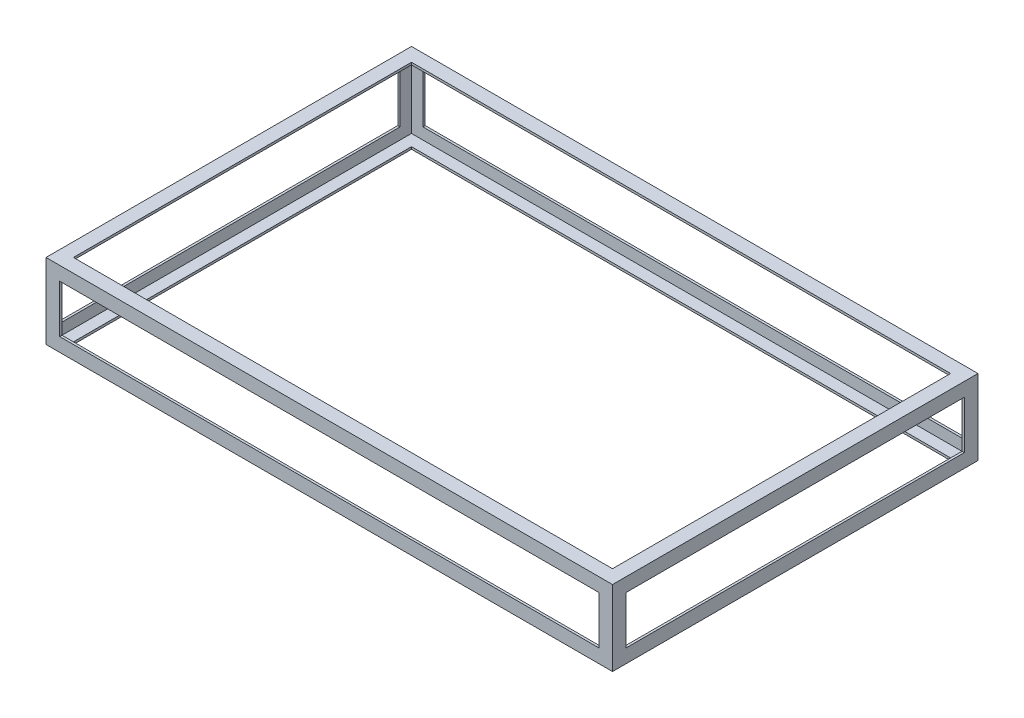
from build123d import *

# Parameters (mm, degrees)
X_ANGLE_LENTH_DEPTH             = 1574.8
X_ANGLE_LENTH_2_DEPTH           = 1574.8
X_ANGLE_LENTH_3_DEPTH           = 1574.8
X_ANGLE_LENTH_4_DEPTH           = 1574.8
Y_ANGLE_LENTH_DEPTH             = 209.55
Z_ANGLE_LENTH_REACH             = 1684.546
Z_ANGLE_LENTH_DIRECTION_2_REACH = 1684.546


with BuildPart() as part:
    # Sketch5 → X Angle Lenth (new body)
    with BuildSketch(Plane(origin=(0, 0, 0), x_dir=(0, 0, -1), z_dir=(1, 0, 0))):
        Polygon((-508, -304.8), (-508, -266.7), (-501.65, -266.7), (-501.65, -298.45), (-469.9, -298.45), (-469.9, -304.8), align=None)
    extrude(amount=X_ANGLE_LENTH_DEPTH)



with BuildPart() as body_2:
    # Sketch5 → X Angle Lenth 2 (new body)
    with BuildSketch(Plane(origin=(0, 0, 0), x_dir=(0, 0, -1), z_dir=(1, 0, 0))):
        Polygon((501.65, -266.7), (508, -266.7), (508, -304.8), (469.9, -304.8), (469.9, -298.45), (501.65, -298.45), align=None)
    extrude(amount=X_ANGLE_LENTH_2_DEPTH)


with BuildPart() as body_3:
    # Sketch5 → X Angle Lenth 3 (new body)
    with BuildSketch(Plane(origin=(0, 0, 0), x_dir=(0, 0, -1), z_dir=(1, 0, 0))):
        Polygon((508, -95.25), (508, -133.35), (501.65, -133.35), (501.65, -101.6), (469.9, -101.6), (469.9, -95.25), align=None)
    extrude(amount=X_ANGLE_LENTH_3_DEPTH)


with BuildPart() as body_4:
    # Sketch5 → X Angle Lenth 4 (new body)
    with BuildSketch(Plane(origin=(0, 0, 0), x_dir=(0, 0, -1), z_dir=(1, 0, 0))):
        Polygon((-501.65, -133.35), (-508, -133.35), (-508, -95.25), (-469.9, -95.25), (-469.9, -101.6), (-501.65, -101.6), align=None)
    extrude(amount=X_ANGLE_LENTH_4_DEPTH)


with BuildPart() as part_1:
    add(part.part)

    add(body_2.part)  # Y Angle Lenth merges body 2

    add(body_3.part)  # Y Angle Lenth merges body 3

    add(body_4.part)  # Y Angle Lenth merges body 4
    # Sketch6 → Y Angle Lenth (add)
    with BuildSketch(Plane.XZ.offset(304.8)):
        Polygon((1574.8, -508), (1536.7, -508), (1536.7, -501.65), (1568.45, -501.65), (1568.45, -469.9), (1574.8, -469.9), align=None)
        Polygon((1536.7, 501.65), (1536.7, 508), (1574.8, 508), (1574.8, 469.9), (1568.45, 469.9), (1568.45, 501.65), align=None)
        Polygon((0, 508), (38.1, 508), (38.1, 501.65), (6.35, 501.65), (6.35, 469.9), (0, 469.9), align=None)
        Polygon((38.1, -501.65), (38.1, -508), (0, -508), (0, -469.9), (6.35, -469.9), (6.35, -501.65), align=None)
    extrude(amount=-Y_ANGLE_LENTH_DEPTH)

    # Sketch15 → Z Angle Lenth (add, up to next)
    with BuildSketch(Plane.XY, mode=Mode.PRIVATE) as z_angle_lenth_sk1:
        Polygon((0, -266.7), (0, -304.8), (38.1, -304.8), (38.1, -298.45), (6.35, -298.45), (6.35, -266.7), align=None)
    z_angle_lenth_tool1 = extrude(z_angle_lenth_sk1.sketch, amount=-Z_ANGLE_LENTH_REACH, mode=Mode.PRIVATE) - part_1.part
    # Sketch15 → Z Angle Lenth (add, up to next)
    with BuildSketch(Plane.XY, mode=Mode.PRIVATE) as z_angle_lenth_sk2:
        Polygon((1568.45, -266.7), (1574.8, -266.7), (1574.8, -304.8), (1536.7, -304.8), (1536.7, -298.45), (1568.45, -298.45), align=None)
    z_angle_lenth_tool2 = extrude(z_angle_lenth_sk2.sketch, amount=-Z_ANGLE_LENTH_REACH, mode=Mode.PRIVATE) - part_1.part
    # Sketch15 → Z Angle Lenth (add, up to next)
    with BuildSketch(Plane.XY, mode=Mode.PRIVATE) as z_angle_lenth_sk3:
        Polygon((1574.8, -133.35), (1574.8, -95.25), (1536.7, -95.25), (1536.7, -101.6), (1568.45, -101.6), (1568.45, -133.35), align=None)
    z_angle_lenth_tool3 = extrude(z_angle_lenth_sk3.sketch, amount=-Z_ANGLE_LENTH_REACH, mode=Mode.PRIVATE) - part_1.part
    # Sketch15 → Z Angle Lenth (add, up to next)
    with BuildSketch(Plane.XY, mode=Mode.PRIVATE) as z_angle_lenth_sk4:
        Polygon((6.35, -133.35), (0, -133.35), (0, -95.25), (38.1, -95.25), (38.1, -101.6), (6.35, -101.6), align=None)
    z_angle_lenth_tool4 = extrude(z_angle_lenth_sk4.sketch, amount=-Z_ANGLE_LENTH_REACH, mode=Mode.PRIVATE) - part_1.part
    add(z_angle_lenth_tool1.solids().sort_by_distance((0.538815, -285.75, 0))[0])
    add(z_angle_lenth_tool2.solids().sort_by_distance((1571.625, -267.238815, 0))[0])
    add(z_angle_lenth_tool3.solids().sort_by_distance((1574.261185, -114.3, 0))[0])
    add(z_angle_lenth_tool4.solids().sort_by_distance((3.175, -132.811185, 0))[0])

    # Sketch15 → Z Angle Lenth direction 2 (add, up to next)
    with BuildSketch(Plane.XY, mode=Mode.PRIVATE) as z_angle_lenth_direction_2_sk1:
        Polygon((0, -266.7), (0, -304.8), (38.1, -304.8), (38.1, -298.45), (6.35, -298.45), (6.35, -266.7), align=None)
    z_angle_lenth_direction_2_tool1 = extrude(z_angle_lenth_direction_2_sk1.sketch, amount=Z_ANGLE_LENTH_DIRECTION_2_REACH, mode=Mode.PRIVATE) - part_1.part
    # Sketch15 → Z Angle Lenth direction 2 (add, up to next)
    with BuildSketch(Plane.XY, mode=Mode.PRIVATE) as z_angle_lenth_direction_2_sk2:
        Polygon((1568.45, -266.7), (1574.8, -266.7), (1574.8, -304.8), (1536.7, -304.8), (1536.7, -298.45), (1568.45, -298.45), align=None)
    z_angle_lenth_direction_2_tool2 = extrude(z_angle_lenth_direction_2_sk2.sketch, amount=Z_ANGLE_LENTH_DIRECTION_2_REACH, mode=Mode.PRIVATE) - part_1.part
    # Sketch15 → Z Angle Lenth direction 2 (add, up to next)
    with BuildSketch(Plane.XY, mode=Mode.PRIVATE) as z_angle_lenth_direction_2_sk3:
        Polygon((1574.8, -133.35), (1574.8, -95.25), (1536.7, -95.25), (1536.7, -101.6), (1568.45, -101.6), (1568.45, -133.35), align=None)
    z_angle_lenth_direction_2_tool3 = extrude(z_angle_lenth_direction_2_sk3.sketch, amount=Z_ANGLE_LENTH_DIRECTION_2_REACH, mode=Mode.PRIVATE) - part_1.part
    # Sketch15 → Z Angle Lenth direction 2 (add, up to next)
    with BuildSketch(Plane.XY, mode=Mode.PRIVATE) as z_angle_lenth_direction_2_sk4:
        Polygon((6.35, -133.35), (0, -133.35), (0, -95.25), (38.1, -95.25), (38.1, -101.6), (6.35, -101.6), align=None)
    z_angle_lenth_direction_2_tool4 = extrude(z_angle_lenth_direction_2_sk4.sketch, amount=Z_ANGLE_LENTH_DIRECTION_2_REACH, mode=Mode.PRIVATE) - part_1.part
    add(z_angle_lenth_direction_2_tool1.solids().sort_by_distance((0.538815, -285.75, 0))[0])
    add(z_angle_lenth_direction_2_tool2.solids().sort_by_distance((1571.625, -267.238815, 0))[0])
    add(z_angle_lenth_direction_2_tool3.solids().sort_by_distance((1574.261185, -114.3, 0))[0])
    add(z_angle_lenth_direction_2_tool4.solids().sort_by_distance((3.175, -132.811185, 0))[0])


solid = part_1.part
